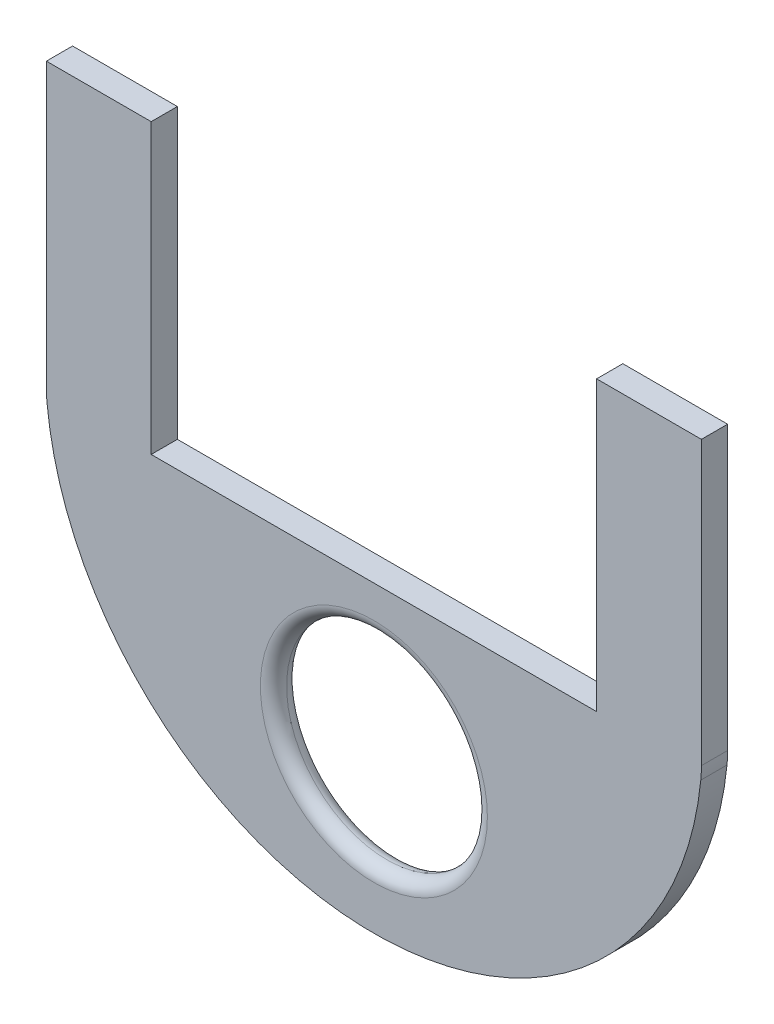
from build123d import *

# Parameters (mm, degrees)
ESQUISSE1_R        = 7.66384886
BOSS_EXTRU_1_DEPTH = 2
CONG_1_R           = 10
CONG_2_R           = 1


# Some blends are built 0.0001 mm under size
with BuildPart() as part:
    # Esquisse1 → Boss.-Extru.1 (new body)
    with BuildSketch(Plane.XY):
        with BuildLine():
            Line((0, 0), (34, 0))
            Line((34, 0), (34, 22))
            Line((34, 22), (42, 22))
            Line((42, 22), (42, 0))
            ThreePointArc((42, 0), (17, -23.15919806), (-8, 0))
            Line((-8, 0), (-8, 22))
            Line((-8, 22), (0, 22))
            Line((0, 22), (0, 0))
        make_face()
        with Locations((17, -11.135898069)):
            Circle(ESQUISSE1_R, mode=Mode.SUBTRACT)
    extrude(amount=BOSS_EXTRU_1_DEPTH)

    # Congé1
    # the kernel refuses this fillet: 10 mm, written as the material it takes off along each edge
    with BuildSketch(Plane(origin=(42, 0, -1.388699458), x_dir=(0, 1, 0), z_dir=(0, 0, 1))) as cong_1_piece_1:
        with BuildLine():
            CenterArc((0.430691066, 10), CONG_1_R, 264.352690034, 5.647309966)
            ThreePointArc((-0.553355337, 0.048535149), (-0.276812081, 0.022735123), (0, 0))
            Line((0, 0), (0.430691066, 0))
        make_face()
    extrude(amount=4.777398915, mode=Mode.SUBTRACT)
    with BuildSketch(Plane(origin=(-8, 0, -1.388699458), x_dir=(0.08737518565273034, -0.9961754749702236, 0), z_dir=(0, 0, 1))) as cong_1_piece_2:
        with BuildLine():
            CenterArc((0.444707979, 9.999386462), CONG_1_R, 264.987378699, 5.647309966)
            Line((-0.429043877, 0.037631712), (0, 0))
            ThreePointArc((0, 0), (0.277739892, -0.001538335), (0.555479783, 0))
        make_face()
    extrude(amount=4.777398915, mode=Mode.SUBTRACT)

    # Congé2
    cong_2_edges = [part.edges().sort_by_distance(p)[0] for p in [
        (9.33615114, -11.135898069, 0),
        (9.33615114, -11.135898069, 2),
    ]]
    fillet(cong_2_edges, radius=CONG_2_R - 0.0001)  # a hair under: the kernel refuses the full size


solid = part.part
